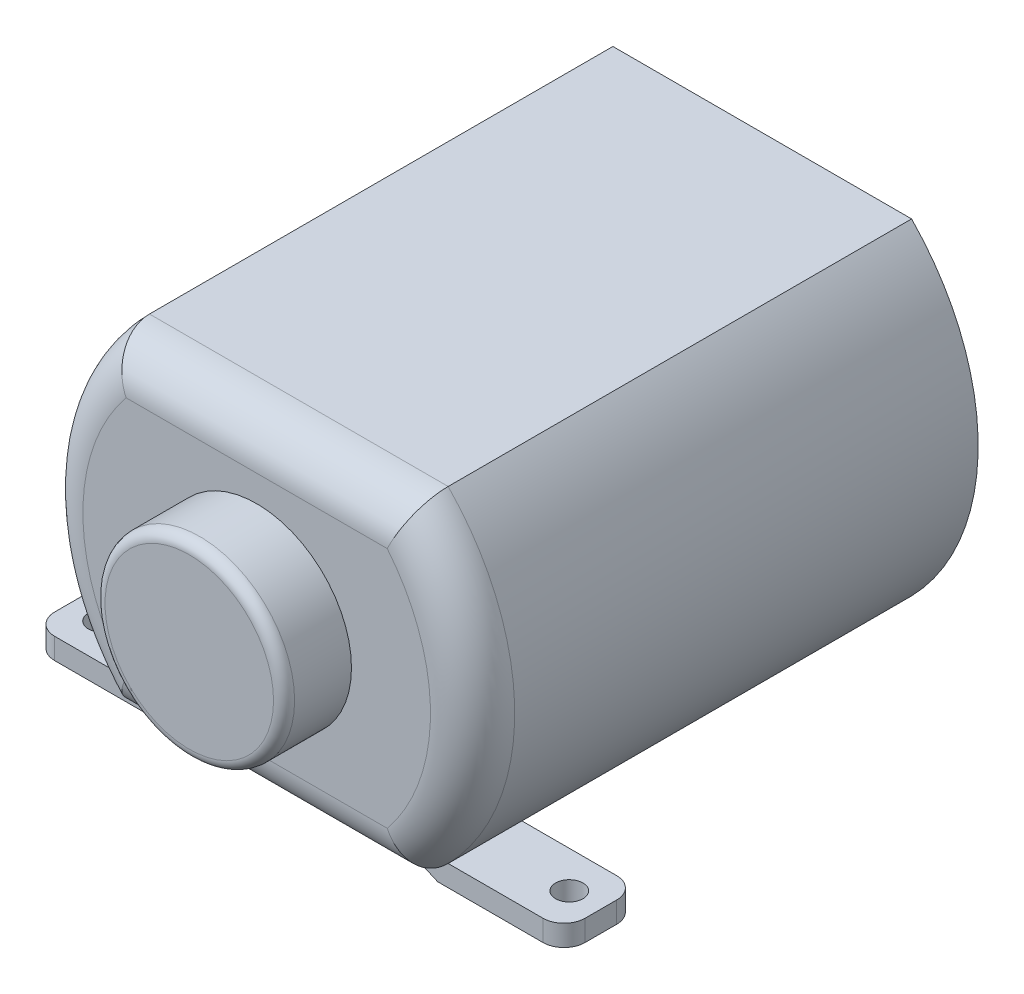
from build123d import *

# Parameters (mm, degrees)
SALIENTE_EXTRUIR1_DEPTH  = 24
REDONDEO1_R              = 2
CROQUIS2_R               = 4.5
SALIENTE_EXTRUIR2_DEPTH  = 3.2
REDONDEO2_R              = 0.5
CROQUIS3_R               = 0.65
SALIENTE_EXTRUIR3_DEPTH  = 1
REDONDEO3_R              = 10
REDONDEO3_OF_SIMETR_A1_R = 10


with BuildPart() as part:
    # Croquis1 → Saliente-Extruir1 (new body)
    with BuildSketch(Plane.XY):
        with BuildLine():
            Line((7.09, 7.75), (-7.09, 7.75))
            ThreePointArc((-7.09, 7.75), (-10.25, 0), (-7.09, -7.75))
            Line((-7.09, -7.75), (7.09, -7.75))
            ThreePointArc((7.09, -7.75), (10.25, 0), (7.09, 7.75))
        make_face()
    extrude(amount=SALIENTE_EXTRUIR1_DEPTH)

    # Redondeo1
    redondeo1_edges = [part.edges().sort_by_distance(p)[0] for p in [
        (10.25, 0, 24),
        (0, 7.75, 24),
        (-10.25, 0, 24),
        (0, -7.75, 24),
    ]]
    fillet(redondeo1_edges, radius=REDONDEO1_R)

    # Croquis2 → Saliente-Extruir2 (add)
    with BuildSketch(Plane.XY.offset(24)):
        Circle(CROQUIS2_R)
    extrude(amount=SALIENTE_EXTRUIR2_DEPTH)

    # Redondeo2
    redondeo2_edges = [part.edges().sort_by_distance(p)[0] for p in [
        (-4.5, 0, 27.2),
    ]]
    fillet(redondeo2_edges, radius=REDONDEO2_R)

    # Croquis3 → Saliente-Extruir3 (add)
    with BuildSketch(Plane.XZ.offset(7.75)):
        with BuildLine():
            Line((-6.59, 22), (-11.59, 22))
            ThreePointArc((-11.59, 22), (-12.297106781, 21.707106781), (-12.59, 21))
            Line((-12.59, 21), (-12.59, 19.5))
            ThreePointArc((-12.59, 19.5), (-12.297106781, 18.792893219), (-11.59, 18.5))
            Line((-11.59, 18.5), (-6.59, 18.5))
            Line((-6.59, 18.5), (-6.59, 22))
        make_face()
        with Locations(Location((-11.09, 20.25, 0), (0, 0, 270))):
            Circle(CROQUIS3_R, mode=Mode.SUBTRACT)
    saliente_extruir3 = extrude(amount=SALIENTE_EXTRUIR3_DEPTH)

    # Redondeo3
    # the kernel refuses this fillet: 10 mm, written as the material it adds along each edge
    with BuildSketch(Plane(origin=(-6.59, -7.75, 18.5), x_dir=(1, 0, 0), z_dir=(0, 0, 1))) as redondeo3_piece_1:
        with BuildLine():
            CenterArc((4.358898944, -10), REDONDEO3_R, 90, 25.841932763)
            Line((0, -1), (-0.087177979, -0.82))
            ThreePointArc((-0.087177979, -0.82), (-0.2, -0.5), (-0.2, 0))
            Line((-0.2, 0), (0, 0.2))
            Line((0, 0.2), (4.358898944, 0.2))
            Line((4.358898944, 0.2), (4.358898944, 0))
        make_face()
    extrude(amount=3.5)

    # Simetría1: Saliente-Extruir3 across plane
    add(saliente_extruir3.mirror(Plane(origin=(0, 0, 0), x_dir=(0, 0, 1), z_dir=(1, 0, 0))))

    # Redondeo3 of Simetría1
    # the kernel refuses this fillet: 10 mm, written as the material it adds along each edge
    with BuildSketch(Plane(origin=(6.59, -7.75, 18.5), x_dir=(-1, 0, 0), z_dir=(0, 0, 1))) as redondeo3_of_simetr_a1_piece_1:
        with BuildLine():
            CenterArc((4.358898944, 10), REDONDEO3_OF_SIMETR_A1_R, 244.158067237, 25.841932763)
            Line((0, 1), (-0.087177979, 0.82))
            ThreePointArc((-0.087177979, 0.82), (-0.2, 0.5), (-0.2, 0))
            Line((-0.2, 0), (0, -0.2))
            Line((0, -0.2), (4.358898944, -0.2))
            Line((4.358898944, -0.2), (4.358898944, 0))
        make_face()
    extrude(amount=3.5)


solid = part.part
